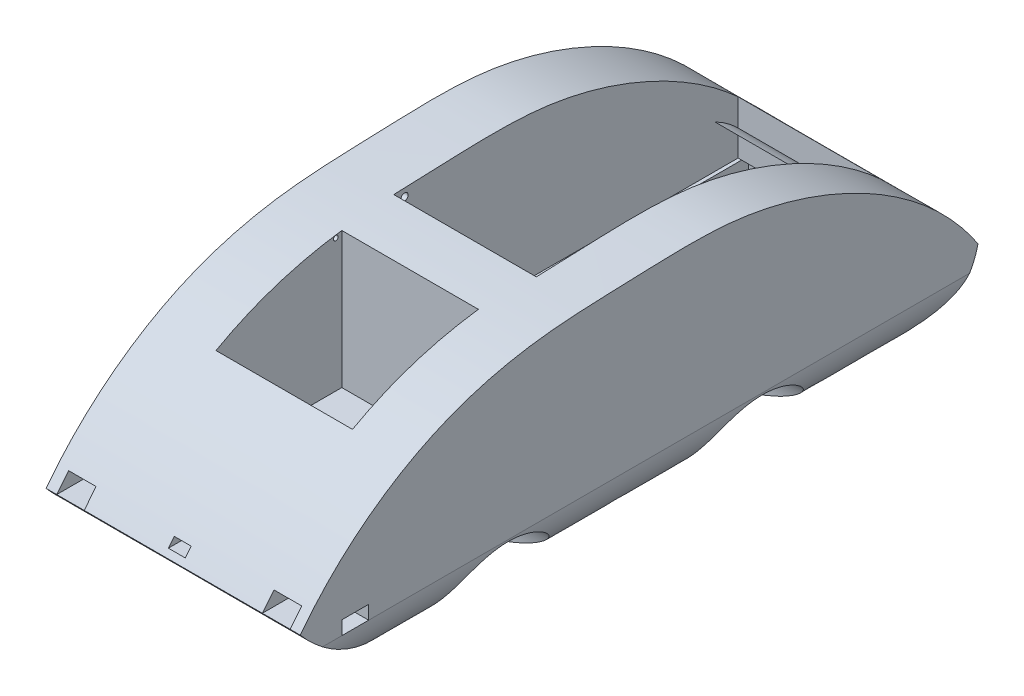
from build123d import *

# Parameters (mm, degrees)
BOSS_EXTRUDE6_DEPTH      = 60
CUT_EXTRUDE7_DEPTH       = 184
CUT_EXTRUDE8_DEPTH       = 184
CUT_EXTRUDE9_DEPTH       = 120
CUT_EXTRUDE10_DEPTH      = 92
SKETCH11_W               = 30
SKETCH11_H               = 87.173069425
CUT_EXTRUDE11_DEPTH      = 10
SKETCH12_W               = 33.656205079
SKETCH12_H               = 81.283461344
CUT_EXTRUDE12_DEPTH      = 52
SKETCH13_W               = 32.232348696
SKETCH13_H               = 29.704321347
CUT_EXTRUDE13_DEPTH      = 76
CUT_EXTRUDE14_DEPTH      = 58
CUT_EXTRUDE14_DEPTH_BACK = 80
SKETCH14_W               = 10.411420884
SKETCH14_H               = 6.114577364
CUT_EXTRUDE15_DEPTH      = 55
CUT_EXTRUDE15_DEPTH_BACK = 61
SKETCH15_W               = 10.411420884
SKETCH15_H               = 7.320322007
CUT_EXTRUDE17_DEPTH      = 12
CUT_EXTRUDE17_DEPTH_BACK = 56
SKETCH16_R               = 15
CUT_EXTRUDE18_DEPTH      = 14
CUT_EXTRUDE18_DEPTH_BACK = 17
SKETCH17_R               = 15
CUT_EXTRUDE20_DEPTH      = 65
CUT_EXTRUDE20_DEPTH_BACK = 2
SKETCH19_R               = 15
CUT_EXTRUDE21_DEPTH      = 64
CUT_EXTRUDE21_DEPTH_BACK = 17
SKETCH20_R               = 15
CUT_EXTRUDE27_DEPTH      = 58
CUT_EXTRUDE27_DEPTH_BACK = 47
SKETCH24_R               = 0.85
SKETCH25_R               = 0.85
BOSS_EXTRUDE7_DEPTH      = 1
EXTRUDE_THIN2_DEPTH      = 56
FILLET2_START            = 14.165654085
FILLET2_DEPTH            = 33.656205079
CUT_EXTRUDE30_DEPTH      = 52
CUT_EXTRUDE30_DEPTH_BACK = 1
SKETCH35_R               = 0.557755218
SKETCH36_W               = 6.480471504
SKETCH36_H               = 3.477871942
CUT_EXTRUDE31_DEPTH      = 7
CUT_EXTRUDE32_DEPTH      = 21
CUT_EXTRUDE32_DEPTH_BACK = 7
SKETCH37_W               = 6.549640058
SKETCH37_H               = 3.401049645
CUT_EXTRUDE33_DEPTH      = 7
CUT_EXTRUDE33_DEPTH_BACK = 10
SKETCH38_W               = 6.36618203
SKETCH38_H               = 3.281738489
CUT_EXTRUDE34_DEPTH      = 14
CUT_EXTRUDE34_DEPTH_BACK = 17
SKETCH39_W               = 6.247497465
SKETCH39_H               = 3.241947513
SKETCH42_W               = 4
SKETCH42_H               = 2.5
CUT_EXTRUDE35_DEPTH      = 1.6
SKETCH43_W               = 4
SKETCH43_H               = 1.718308329
CUT_EXTRUDE36_DEPTH      = 2.6
SKETCH44_W               = 4
SKETCH44_H               = 1.636871897
CUT_EXTRUDE37_DEPTH      = 4.6


with BuildPart() as part:
    # Sketch1 → Boss-Extrude6 (new body)
    with BuildSketch(Plane(origin=(0, 0, 0), x_dir=(0, 0, -1), z_dir=(1, 0, 0))):
        with BuildLine():
            ThreePointArc((117.204464523, -21.207702301), (109.35947202, -13.210942146), (101.210539055, -20.897747196))
            Line((101.210539055, -20.897747196), (57.203634074, -21.337845047))
            ThreePointArc((57.203634074, -21.337845047), (49.623977338, -13.233473676), (41.237207044, -20.499429606))
            add(Edge.make_bspline(
                [(0, 0), (7.469010608, -8.97469377), (25.480717518, -16.176463473), (37.825075569, -20.037017712), (41.237207044, -20.499429606)],
                knots=[0, 0, 0, 0, 0.212366999, 0.271912374, 0.271912374, 0.271912374, 0.271912374], degree=3))
            Line((0, 0), (160, 0))
            add(Edge.make_bspline(
                [(117.204464523, -21.207702301), (120.644583313, -21.331542484), (129.530308404, -21.356426087), (143.031299771, -16.15436819), (155.39699856, -9.652856225), (159.225486849, -3.616788828), (160, 0)],
                knots=[0.704702826, 0.704702826, 0.704702826, 0.704702826, 0.763972143, 0.874905323, 0.943376804, 1, 1, 1, 1], degree=3))
        make_face()
        with BuildLine():
            add(Edge.make_bspline(
                [(0, 0), (9.08628336, 11.900809017), (27.172081028, 25.925787199), (56.007124825, 32.97858791), (78.657565927, 33.453519554), (102.97387365, 34.712647714), (133.267395862, 26.098166791), (151.941969321, 12.151413375), (160, 0)],
                knots=[0, 0, 0, 0, 0.249139892, 0.361443299, 0.486953039, 0.624480435, 0.762520098, 1, 1, 1, 1], degree=3))
            Line((160, 0), (0, 0))
        make_face()
    extrude(amount=BOSS_EXTRUDE6_DEPTH)

    # Sketch7 → Cut-Extrude7 (cut)
    with BuildSketch(Plane.XY):
        with BuildLine():
            Line((15.115569873, -20.499429606), (11.260135972, -27.156645317))
            Line((11.260135972, -27.156645317), (-10.144169478, -25.561293358))
            Line((-10.144169478, -25.561293358), (-11.28841502, -14.097965578))
            Line((-11.28841502, -14.097965578), (-8.151708617, 1.17088985))
            Line((-8.151708617, 1.17088985), (0, 0))
            add(Edge.make_bspline(
                [(0, 0), (-1.781202154, -14.065068279), (15.115569873, -20.499429606)],
                knots=[0, 0, 0, 1, 1, 1], degree=2))
        make_face()
    extrude(amount=-CUT_EXTRUDE7_DEPTH, mode=Mode.SUBTRACT)

    # Sketch8 → Cut-Extrude8 (cut)
    with BuildSketch(Plane.XY):
        with BuildLine():
            Line((45.108669444, -20.499429606), (46.709813413, -23.448442282))
            Line((46.709813413, -23.448442282), (65.351703907, -25.850158236))
            Line((65.351703907, -25.850158236), (67.75341986, -15.442722438))
            Line((67.75341986, -15.442722438), (63.979294791, -2.290468409))
            Line((63.979294791, -2.290468409), (60, 0))
            add(Edge.make_bspline(
                [(60, 0), (61.746338322, -13.955964584), (45.108669444, -20.499429606)],
                knots=[0, 0, 0, 1, 1, 1], degree=2))
        make_face()
    extrude(amount=-CUT_EXTRUDE8_DEPTH, mode=Mode.SUBTRACT)

    # Sketch9 → Cut-Extrude9 (cut)
    with BuildSketch(Plane(origin=(0, 0, 0), x_dir=(0, 0, -1), z_dir=(1, 0, 0))):
        Polygon((101.236034201, -20.499429606), (104.634297024, -23.89769243), (51.424855877, -23.175822004), (57.171725209, -20.499429606), align=None)
    extrude(amount=CUT_EXTRUDE9_DEPTH, mode=Mode.SUBTRACT)

    # Sketch10 → Cut-Extrude10 (cut)
    with BuildSketch(Plane(origin=(0, 0, 0), x_dir=(0, 0, -1), z_dir=(1, 0, 0))):
        Polygon((129.235048318, -20.499429606), (128.462027321, -23.424845353), (116.148021058, -22.835345054), (115.034520492, -20.499429606), (117.172895223, -20.499429606), align=None)
    extrude(amount=CUT_EXTRUDE10_DEPTH, mode=Mode.SUBTRACT)

    # Sketch11 → Cut-Extrude11 (cut)
    with BuildSketch(Plane(origin=(0, 0, 0), x_dir=(1, 0, 0), z_dir=(0, 1, 0))):
        with Locations((30, 107.200675592)):
            Rectangle(SKETCH11_W, SKETCH11_H)
    extrude(amount=-CUT_EXTRUDE11_DEPTH, mode=Mode.SUBTRACT)

    # Sketch12 → Cut-Extrude12 (cut)
    with BuildSketch(Plane(origin=(0, 0, 0), x_dir=(1, 0, 0), z_dir=(0, 1, 0))):
        with Locations((30.993756625, 108.564771705)):
            Rectangle(SKETCH12_W, SKETCH12_H)
    extrude(amount=CUT_EXTRUDE12_DEPTH, mode=Mode.SUBTRACT)

    # Sketch13 → Cut-Extrude13 (cut)
    with BuildSketch(Plane(origin=(0, 0, 0), x_dir=(1, 0, 0), z_dir=(0, 1, 0))):
        with Locations((30.434613031, 40.657574387)):
            Rectangle(SKETCH13_W, SKETCH13_H)
    extrude(amount=CUT_EXTRUDE13_DEPTH, mode=Mode.SUBTRACT)

    # Sketch14 → Cut-Extrude14 (cut, two sides: drawn at the far end of the back side and taken through both)
    with BuildSketch(Plane(origin=(0, 0, 0), x_dir=(1, 0, 0), z_dir=(0, 1, 0)).offset(-CUT_EXTRUDE14_DEPTH_BACK)):
        with Locations((29.525165144, 124.820166019)):
            Rectangle(SKETCH14_W, SKETCH14_H)
    extrude(amount=CUT_EXTRUDE14_DEPTH + CUT_EXTRUDE14_DEPTH_BACK, mode=Mode.SUBTRACT)

    # Sketch15 → Cut-Extrude15 (cut, two sides: drawn at the far end of the back side and taken through both)
    with BuildSketch(Plane(origin=(0, 0, 0), x_dir=(1, 0, 0), z_dir=(0, 1, 0)).offset(-CUT_EXTRUDE15_DEPTH_BACK)):
        with Locations((29.525165144, 76.548042877)):
            Rectangle(SKETCH15_W, SKETCH15_H)
    extrude(amount=CUT_EXTRUDE15_DEPTH + CUT_EXTRUDE15_DEPTH_BACK, mode=Mode.SUBTRACT)

    # Sketch16 → Cut-Extrude17 (cut, two sides: drawn at the far end of the back side and taken through both)
    with BuildSketch(Plane(origin=(0, 0, 0), x_dir=(0, 0, -1), z_dir=(1, 0, 0)).offset(-CUT_EXTRUDE17_DEPTH_BACK)):
        with Locations((49.204466126, -20.499429606)):
            Circle(SKETCH16_R)
    extrude(amount=CUT_EXTRUDE17_DEPTH + CUT_EXTRUDE17_DEPTH_BACK, mode=Mode.SUBTRACT)

    # Sketch17 → Cut-Extrude18 (cut, two sides: drawn at the far end of the back side and taken through both)
    with BuildSketch(Plane(origin=(0, 0, 0), x_dir=(0, 0, -1), z_dir=(1, 0, 0)).offset(-CUT_EXTRUDE18_DEPTH_BACK)):
        with Locations((109.204464712, -20.499429606)):
            Circle(SKETCH17_R)
    extrude(amount=CUT_EXTRUDE18_DEPTH + CUT_EXTRUDE18_DEPTH_BACK, mode=Mode.SUBTRACT)

    # Sketch19 → Cut-Extrude20 (cut, two sides: drawn at the far end of the back side and taken through both)
    with BuildSketch(Plane(origin=(0, 0, 0), x_dir=(0, 0, -1), z_dir=(1, 0, 0)).offset(-CUT_EXTRUDE20_DEPTH_BACK)):
        with Locations((49.204466126, -20.499429606)):
            Circle(SKETCH19_R)
    extrude(amount=CUT_EXTRUDE20_DEPTH + CUT_EXTRUDE20_DEPTH_BACK, mode=Mode.SUBTRACT)

    # Sketch20 → Cut-Extrude21 (cut, two sides: drawn at the far end of the back side and taken through both)
    with BuildSketch(Plane(origin=(0, 0, 0), x_dir=(0, 0, -1), z_dir=(1, 0, 0)).offset(-CUT_EXTRUDE21_DEPTH_BACK)):
        with Locations((109.204464712, -20.499429606)):
            Circle(SKETCH20_R)
    extrude(amount=CUT_EXTRUDE21_DEPTH + CUT_EXTRUDE21_DEPTH_BACK, mode=Mode.SUBTRACT)

    # Sketch24 → Cut-Extrude27 (cut, two sides: drawn at the far end of the back side and taken through both)
    with BuildSketch(Plane(origin=(0, 0, 0), x_dir=(0, 0, -1), z_dir=(1, 0, 0)).offset(-CUT_EXTRUDE27_DEPTH_BACK)):
        with Locations((70.468416116, 31.394548963)):
            Circle(SKETCH24_R)
    extrude(amount=CUT_EXTRUDE27_DEPTH + CUT_EXTRUDE27_DEPTH_BACK, mode=Mode.SUBTRACT)

    # Sketch25 → Boss-Extrude7 (add)
    with BuildSketch(Plane(origin=(0, 0, 0), x_dir=(0, 0, -1), z_dir=(1, 0, 0))):
        with Locations((70.468416116, 31.394548963)):
            Circle(SKETCH25_R)
    extrude(amount=BOSS_EXTRUDE7_DEPTH)

    # Sketch26 → Extrude-Thin2 (add)
    with BuildSketch(Plane(origin=(0, 0, 0), x_dir=(0, 0, -1), z_dir=(1, 0, 0))):
        Polygon((144.458674708, 10.804674443), (150.064438033, 5.289223092), (149.363096574, 4.576397617), (143.757333249, 10.091848968), align=None)
    extrude(amount=EXTRUDE_THIN2_DEPTH)

    # Fillet2: read off the stored shape, not the designer's step
    # Fillet2 outline → Fillet2 (cut)
    with BuildSketch(Plane.YZ.offset(FILLET2_START)):
        with BuildLine():
            Line((10.804674443, -144.458674708), (10.091848968, -143.757333249))
            ThreePointArc((10.091848968, -143.757333249), (8.463300561, -146.479671171), (6.424798435, -148.910268373))
            Line((6.424798435, -148.910268373), (10.804674443, -144.458674708))
        make_face()
    extrude(amount=FILLET2_DEPTH, mode=Mode.SUBTRACT)

    # Sketch35 → Cut-Extrude30 (cut, two sides: drawn at the far end of the back side and taken through both)
    with BuildSketch(Plane(origin=(0, 0, 0), x_dir=(0, 0, -1), z_dir=(1, 0, 0)).offset(-CUT_EXTRUDE30_DEPTH_BACK)):
        with Locations((54.086916814, 31.283483794)):
            Circle(SKETCH35_R)
    extrude(amount=CUT_EXTRUDE30_DEPTH + CUT_EXTRUDE30_DEPTH_BACK, mode=Mode.SUBTRACT)

    # Sketch36 → Cut-Extrude31 (cut)
    with BuildSketch(Plane.XY):
        with Locations((5.777254412, 1.738935971)):
            Rectangle(SKETCH36_W, SKETCH36_H)
    extrude(amount=-CUT_EXTRUDE31_DEPTH, mode=Mode.SUBTRACT)

    # Sketch37 → Cut-Extrude32 (cut, two sides: drawn at the far end of the back side and taken through both)
    with BuildSketch(Plane.XY.offset(-CUT_EXTRUDE32_DEPTH_BACK)):
        with Locations((54.348471727, 1.700524823)):
            Rectangle(SKETCH37_W, SKETCH37_H)
    extrude(amount=CUT_EXTRUDE32_DEPTH + CUT_EXTRUDE32_DEPTH_BACK, mode=Mode.SUBTRACT)

    # Sketch38 → Cut-Extrude33 (cut, two sides: drawn at the far end of the back side and taken through both)
    with BuildSketch(Plane(origin=(0, 0, 0), x_dir=(0, 0, -1), z_dir=(1, 0, 0)).offset(-CUT_EXTRUDE33_DEPTH_BACK)):
        with Locations((12.022097742, -3.394417404)):
            Rectangle(SKETCH38_W, SKETCH38_H)
    extrude(amount=CUT_EXTRUDE33_DEPTH + CUT_EXTRUDE33_DEPTH_BACK, mode=Mode.SUBTRACT)

    # Sketch39 → Cut-Extrude34 (cut, two sides: drawn at the far end of the back side and taken through both)
    with BuildSketch(Plane(origin=(70, 0, 0), x_dir=(0, 0, -1), z_dir=(1, 0, 0)).offset(-CUT_EXTRUDE34_DEPTH_BACK)):
        with Locations((13.035275938, -3.414312892)):
            Rectangle(SKETCH39_W, SKETCH39_H)
    extrude(amount=CUT_EXTRUDE34_DEPTH + CUT_EXTRUDE34_DEPTH_BACK, mode=Mode.SUBTRACT)

    # Sketch42 → Cut-Extrude35 (cut)
    with BuildSketch(Plane.XY):
        with Locations((29.920920034, 2.488992046)):
            Rectangle(SKETCH42_W, SKETCH42_H)
    extrude(amount=-CUT_EXTRUDE35_DEPTH, mode=Mode.SUBTRACT)

    # Sketch43 → Cut-Extrude36 (cut)
    with BuildSketch(Plane.XY):
        with Locations((29.920920034, 2.09814621)):
            Rectangle(SKETCH43_W, SKETCH43_H)
    extrude(amount=-CUT_EXTRUDE36_DEPTH, mode=Mode.SUBTRACT)

    # Sketch44 → Cut-Extrude37 (cut)
    with BuildSketch(Plane.XY):
        with Locations((29.920920034, 2.057427995)):
            Rectangle(SKETCH44_W, SKETCH44_H)
    extrude(amount=-CUT_EXTRUDE37_DEPTH, mode=Mode.SUBTRACT)


solid = part.part
